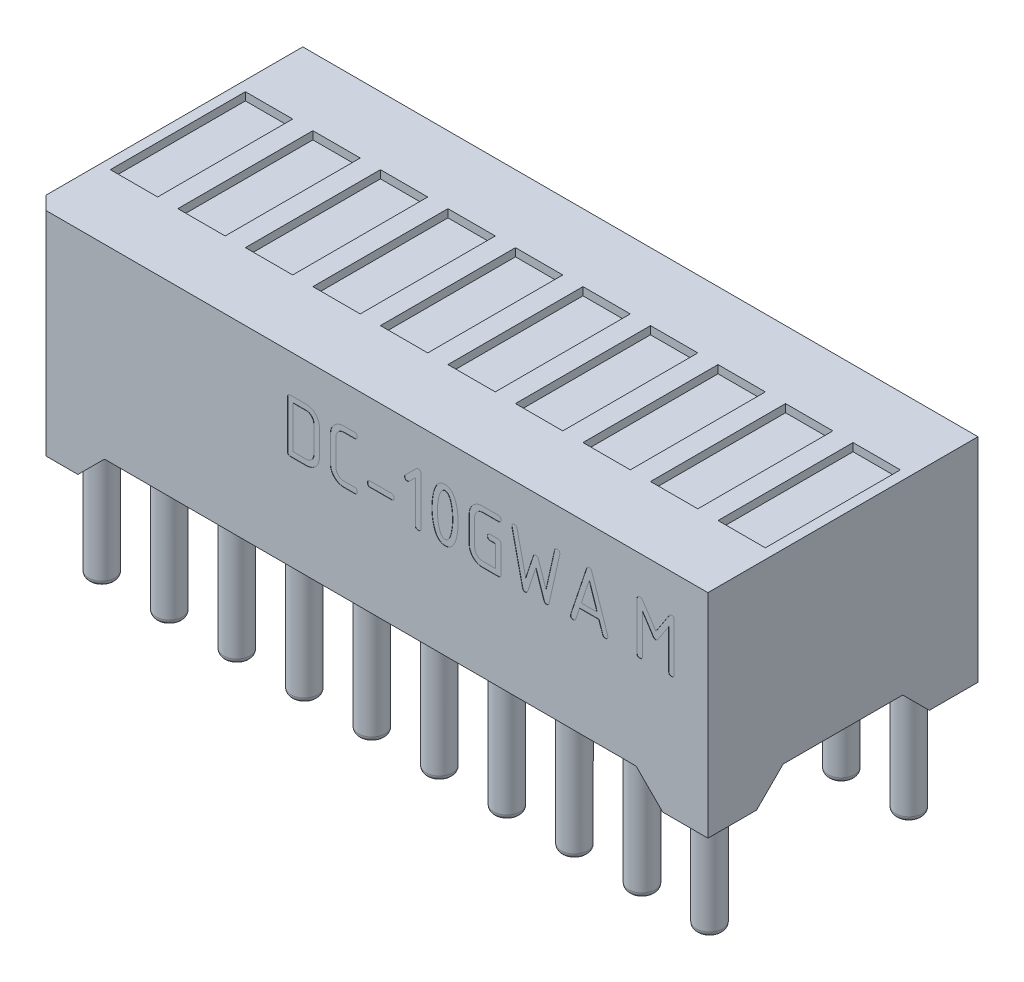
from build123d import *

# Parameters (mm, degrees)
SKETCH_1_W                 = 25.4
SKETCH_1_H                 = 10.16
EXTRUDE_1_DEPTH            = 8
SKETCH_2_W                 = 4.5
SKETCH_2_H                 = 2
CUT_EXTRUDE_1_DEPTH        = 28.110263739
CHAMFER_1_SIZE             = 1
SKETCH_3_W                 = 20
SKETCH_3_H                 = 2
CUT_EXTRUDE_2_DEPTH        = 19.12499931
CHAMFER_2_SIZE             = 1
SKETCH_4_W                 = 1.78
SKETCH_4_H                 = 5.08
CUT_EXTRUDE_3_DEPTH        = 0.3
PATTERN_LINEAR_1_COUNT     = 6
PATTERN_LINEAR_1_PITCH     = 2.54
PATTERN_LINEAR_1_COL_COUNT = 5
PATTERN_LINEAR_1_COL_PITCH = 2.54
SKETCH_5_R                 = 0.5
EXTRUDE_2_DEPTH            = 5.2
PATTERN_LINEAR_2_COUNT     = 6
PATTERN_LINEAR_2_PITCH     = 2.54
PATTERN_LINEAR_2_COL_COUNT = 5
PATTERN_LINEAR_2_COL_PITCH = 2.54
FILLET_1_R                 = 0.2
CHAMFER_3_SIZE             = 0.5
CUT_EXTRUDE_4_DEPTH        = 0.01


with BuildPart() as part:
    # Эскиз1 → Бобышка-Вытянуть1 (new body)
    with BuildSketch(Plane(origin=(0, 0, 0), x_dir=(1, 0, 0), z_dir=(0, 1, 0))):
        Rectangle(SKETCH_1_W, SKETCH_1_H)
    extrude(amount=EXTRUDE_1_DEPTH)

    # Эскиз2 → Вырез-Вытянуть1 (cut, through all)
    with BuildSketch(Plane(origin=(12.7, 0, 0), x_dir=(0, 0, -1), z_dir=(1, 0, 0))):
        Rectangle(SKETCH_2_W, SKETCH_2_H)
    extrude(amount=-CUT_EXTRUDE_1_DEPTH, mode=Mode.SUBTRACT)

    # Фаска1
    chamfer_1_edges = [part.edges().sort_by_distance(p)[0] for p in [
        (0, 0, -2.25),
        (0, 0, 2.25),
    ]]
    chamfer(chamfer_1_edges, length=CHAMFER_1_SIZE - 0.0001)  # a hair under: the kernel refuses the full size

    # Эскиз3 → Вырез-Вытянуть2 (cut, through all)
    with BuildSketch(Plane(origin=(0, 0, -5.08), x_dir=(-1, 0, 0), z_dir=(0, 0, -1))):
        Rectangle(SKETCH_3_W, SKETCH_3_H)
    extrude(amount=-CUT_EXTRUDE_2_DEPTH, mode=Mode.SUBTRACT)

    # Фаска2
    chamfer_2_edges = [part.edges().sort_by_distance(p)[0] for p in [
        (-10, 0, 4.16495),
        (10, 0, 4.16495),
        (-10, 0, -4.16495),
        (10, 0, -4.16495),
    ]]
    chamfer(chamfer_2_edges, length=CHAMFER_2_SIZE - 0.0001)  # a hair under: the kernel refuses the full size

    # Эскиз4 → Вырез-Вытянуть3 (cut)
    with BuildSketch(Plane(origin=(0, 8, 0), x_dir=(1, 0, 0), z_dir=(0, 1, 0))):
        with Locations((1.27, 0)):
            Rectangle(SKETCH_4_W, SKETCH_4_H)
    cut_extrude_3 = extrude(amount=-CUT_EXTRUDE_3_DEPTH, mode=Mode.SUBTRACT)

    # Линейный массив1: Вырез-Вытянуть3 ×6
    with Locations(*[(-i * PATTERN_LINEAR_1_PITCH, 0, 0) for i in range(1, PATTERN_LINEAR_1_COUNT)]):
        add(cut_extrude_3, mode=Mode.SUBTRACT)

    # Линейный массив1 col: Вырез-Вытянуть3 ×5
    with Locations(*[(i * PATTERN_LINEAR_1_COL_PITCH, 0, 0) for i in range(1, PATTERN_LINEAR_1_COL_COUNT)]):
        add(cut_extrude_3, mode=Mode.SUBTRACT)

    # Эскиз5 → Бобышка-Вытянуть2 (add)
    with BuildSketch(Plane.XZ.offset(-1)):
        with Locations(Location((-1.27, 3.75, 0), (0, 0, 90))):
            Circle(SKETCH_5_R)
        with Locations(Location((-1.27, -3.75, 0), (0, 0, 90))):
            Circle(SKETCH_5_R)
    extrude_2 = extrude(amount=EXTRUDE_2_DEPTH)

    # Линейный массив2: Бобышка-Вытянуть2 ×6
    with Locations(*[(i * PATTERN_LINEAR_2_PITCH, 0, 0) for i in range(1, PATTERN_LINEAR_2_COUNT)]):
        add(extrude_2)

    # Линейный массив2 col: Бобышка-Вытянуть2 ×5
    with Locations(*[(-i * PATTERN_LINEAR_2_COL_PITCH, 0, 0) for i in range(1, PATTERN_LINEAR_2_COL_COUNT)]):
        add(extrude_2)

    # Скругление1
    fillet_1_edges = [part.edges().sort_by_distance(p)[0] for p in [
        (-1.27, -4.2, 3.25),
        (-1.27, -4.2, -4.25),
        (-3.81, -4.2, 3.25),
        (-3.81, -4.2, -4.25),
        (-6.35, -4.2, 3.25),
        (-6.35, -4.2, -4.25),
        (-8.89, -4.2, 3.25),
        (-8.89, -4.2, -4.25),
        (-11.43, -4.2, 3.25),
        (-11.43, -4.2, -4.25),
        (1.27, -4.2, 3.25),
        (1.27, -4.2, -4.25),
        (3.81, -4.2, 3.25),
        (3.81, -4.2, -4.25),
        (6.35, -4.2, 3.25),
        (6.35, -4.2, -4.25),
        (8.89, -4.2, 3.25),
        (8.89, -4.2, -4.25),
        (11.43, -4.2, 3.25),
        (11.43, -4.2, -4.25),
    ]]
    fillet(fillet_1_edges, radius=FILLET_1_R)

    # Фаска3
    chamfer_3_edges = [part.edges().sort_by_distance(p)[0] for p in [
        (-12.7, 4, 5.08),
    ]]
    chamfer(chamfer_3_edges, length=CHAMFER_3_SIZE)

    # Эскиз6 → Вырез-Вытянуть4 (cut)
    # profile 1 of 9: a face of its own
    with BuildSketch(Plane.XY.offset(5.08)):
        with BuildLine():
            add(Edge.make_bspline(
                [(-3.111938351, 6.481594752), (-3.11162622, 6.489459708), (-3.111039228, 6.504250489), (-3.106750763, 6.524996341), (-3.098857909, 6.542564769), (-3.087902757, 6.557320883), (-3.072859942, 6.567828954), (-3.055630956, 6.576386623), (-3.034868168, 6.580459432), (-3.020228181, 6.581096436), (-3.012506533, 6.581432414)],
                knots=[0, 0, 0, 0, 1.168332916, 2.197158541, 3.123535467, 4.011857721, 4.888049796, 5.822888943, 6.851714568, 8, 8, 8, 8], degree=3))
            Line((-3.012506533, 6.581432414), (-2.415103936, 6.581432414))
            add(Edge.make_bspline(
                [(-2.415103936, 6.581432414), (-2.397904763, 6.580911898), (-2.364194753, 6.579891696), (-2.314525617, 6.573403355), (-2.266969092, 6.561963277), (-2.221384675, 6.546157153), (-2.177872273, 6.52578001), (-2.136924791, 6.500165619), (-2.097186729, 6.471150891), (-2.060689868, 6.437028465), (-2.027311367, 6.400078926), (-1.997648185, 6.360876687), (-1.972887784, 6.319311947), (-1.952455029, 6.275678684), (-1.936603928, 6.229971248), (-1.925117373, 6.182288043), (-1.918700521, 6.132472784), (-1.917661284, 6.098630599), (-1.917133157, 6.081432414)],
                knots=[0, 0, 0, 0, 1.049457071, 2.056913407, 3.049929083, 4.028847935, 4.996249898, 5.974472506, 6.97159638, 7.993822638, 9.016581965, 10.007090152, 10.98809477, 11.962968485, 12.941887336, 13.934903012, 14.950542929, 16, 16, 16, 16], degree=3))
            Line((-1.917133157, 6.081432414), (-1.917133157, 5.081432414))
            add(Edge.make_bspline(
                [(-1.917133157, 5.081432414), (-1.917662537, 5.064503571), (-1.918708224, 5.031063972), (-1.925158481, 4.981805851), (-1.936463584, 4.934410267), (-1.953091029, 4.889216573), (-1.973178228, 4.845444183), (-1.998616316, 4.803961511), (-2.028534909, 4.76442838), (-2.06214729, 4.726993604), (-2.099324385, 4.693278751), (-2.1384694, 4.663149498), (-2.179981053, 4.638146615), (-2.223177377, 4.61707282), (-2.268480409, 4.601376355), (-2.315615849, 4.589891486), (-2.364705723, 4.582892088), (-2.398171231, 4.581922833), (-2.415103936, 4.581432414)],
                knots=[0, 0, 0, 0, 1.03519463, 2.0448233, 3.031937184, 4.007931936, 4.984907729, 5.972298853, 6.976525039, 8.013172852, 9.043696885, 10.04132603, 11.028717155, 12.001762851, 12.974984337, 13.954059048, 14.96480537, 16, 16, 16, 16], degree=3))
            Line((-2.415103936, 4.581432414), (-3.012506533, 4.581432414))
            add(Edge.make_bspline(
                [(-3.012506533, 4.581432414), (-3.020230997, 4.581765001), (-3.034876323, 4.582395574), (-3.055603334, 4.586511474), (-3.073024987, 4.59496228), (-3.087625618, 4.605968874), (-3.099005597, 4.620306331), (-3.106719007, 4.637896492), (-3.111048827, 4.658605874), (-3.111629552, 4.673402181), (-3.111938351, 4.681270076)],
                knots=[0, 0, 0, 0, 1.148816053, 2.178117097, 3.113388232, 4.002120978, 4.875021152, 5.801826155, 6.831127199, 8, 8, 8, 8], degree=3))
            Line((-3.111938351, 4.681270076), (-3.111938351, 6.481594752))
        make_face()
        with BuildLine():
            Line((-2.904146144, 6.373640206), (-2.904146144, 4.789224622))
            Line((-2.904146144, 4.789224622), (-2.417133157, 4.789224622))
            add(Edge.make_bspline(
                [(-2.417133157, 4.789224622), (-2.397507578, 4.790080265), (-2.359120354, 4.791753885), (-2.304386844, 4.809696219), (-2.253642744, 4.836643393), (-2.209324884, 4.874944075), (-2.171993535, 4.920259664), (-2.144738329, 4.971563348), (-2.127647713, 5.027463721), (-2.125844893, 5.066428538), (-2.124925364, 5.086302544)],
                knots=[0, 0, 0, 0, 1.014160611, 1.983677042, 2.956612849, 3.976867765, 4.998953513, 5.984250618, 6.971866922, 8, 8, 8, 8], degree=3))
            Line((-2.124925364, 5.086302544), (-2.124925364, 6.076562284))
            add(Edge.make_bspline(
                [(-2.124925364, 6.076562284), (-2.125851315, 6.0964322), (-2.127666727, 6.135388995), (-2.144630787, 6.191232311), (-2.172143997, 6.242223522), (-2.203055349, 6.280090366), (-2.232031583, 6.306866551), (-2.255088292, 6.324703585), (-2.279270134, 6.34010751), (-2.304925682, 6.352023919), (-2.33131652, 6.361964982), (-2.358935148, 6.368920406), (-2.387650268, 6.373032541), (-2.407244129, 6.373436386), (-2.417133157, 6.373640206)],
                knots=[0, 0, 0, 0, 1.541734475, 3.022712119, 4.490935413, 6.023601629, 6.797673405, 7.555057682, 8.28756636, 9.021508447, 9.750307429, 10.477358599, 11.231522441, 12, 12, 12, 12], degree=3))
            Line((-2.417133157, 6.373640206), (-2.904146144, 6.373640206))
        make_face(mode=Mode.SUBTRACT)
    # profile 2 of 9: a face of its own
    with BuildSketch(Plane.XY.offset(5.08)):
        with BuildLine():
            add(Edge.make_bspline(
                [(-0.591240299, 6.581432414), (-0.583361415, 6.581172043), (-0.568514065, 6.580681387), (-0.547736914, 6.575692647), (-0.529899354, 6.567803837), (-0.515528458, 6.55585526), (-0.504404806, 6.540797618), (-0.496099985, 6.522616273), (-0.491931179, 6.500987455), (-0.491320796, 6.485668104), (-0.490996793, 6.47753631)],
                knots=[0, 0, 0, 0, 1.14095523, 2.150070966, 3.080760824, 3.945153579, 4.828279774, 5.776800167, 6.819884637, 8, 8, 8, 8], degree=3))
            add(Edge.make_bspline(
                [(-0.490996793, 6.47753631), (-0.491320796, 6.469404517), (-0.491931179, 6.454085166), (-0.496099985, 6.432456347), (-0.504404806, 6.414275002), (-0.515528458, 6.399217361), (-0.529899354, 6.387268784), (-0.547736914, 6.379379974), (-0.568514065, 6.374391233), (-0.583361415, 6.373900577), (-0.591240299, 6.373640206)],
                knots=[0, 0, 0, 0, 1.180115363, 2.223199833, 3.171720226, 4.054846421, 4.919239176, 5.849929034, 6.85904477, 8, 8, 8, 8], degree=3))
            Line((-0.591240299, 6.373640206), (-0.99262017, 6.373640206))
            add(Edge.make_bspline(
                [(-0.99262017, 6.373640206), (-1.002914858, 6.373437363), (-1.023316562, 6.373035374), (-1.053236587, 6.368906429), (-1.081960394, 6.362040299), (-1.109277872, 6.35202217), (-1.135741294, 6.340122394), (-1.160728288, 6.324708736), (-1.184569568, 6.307000257), (-1.206844358, 6.286724154), (-1.226987313, 6.264492319), (-1.244844528, 6.241043376), (-1.260112192, 6.216522914), (-1.272238388, 6.19070489), (-1.282142722, 6.163872376), (-1.28898181, 6.135690153), (-1.293158023, 6.106451299), (-1.293555792, 6.086587088), (-1.293756533, 6.076562284)],
                knots=[0, 0, 0, 0, 1.048872021, 2.078622972, 3.071996665, 4.053429411, 5.040658069, 6.024509927, 7.039472989, 8.064503896, 9.089534802, 10.093477104, 11.065564512, 12.027820687, 12.99628217, 13.976260581, 14.978686353, 16, 16, 16, 16], degree=3))
            Line((-1.293756533, 6.076562284), (-1.293756533, 5.086302544))
            add(Edge.make_bspline(
                [(-1.293756533, 5.086302544), (-1.293597861, 5.076272565), (-1.293283142, 5.056378556), (-1.288487742, 5.027195971), (-1.281614947, 4.999096781), (-1.27245724, 4.971949958), (-1.259465305, 4.946398949), (-1.244602219, 4.921460552), (-1.226553892, 4.897861318), (-1.206028357, 4.875712057), (-1.183363822, 4.855611139), (-1.159654623, 4.837647475), (-1.134474165, 4.8229401), (-1.108396426, 4.810712064), (-1.081136776, 4.800845015), (-1.052557032, 4.793997506), (-1.022912982, 4.789823811), (-1.002779957, 4.789425582), (-0.99262017, 4.789224622)],
                knots=[0, 0, 0, 0, 1.022100548, 2.027290177, 3.008023641, 3.972602167, 4.941613295, 5.926223191, 6.93093901, 7.966093497, 9.002167549, 10.017912619, 10.995436454, 11.970912299, 12.953101218, 13.947240284, 14.964109795, 16, 16, 16, 16], degree=3))
            Line((-0.99262017, 4.789224622), (-0.591240299, 4.789224622))
            add(Edge.make_bspline(
                [(-0.591240299, 4.789224622), (-0.583361415, 4.788964251), (-0.568514065, 4.788473595), (-0.547736914, 4.783484855), (-0.529899354, 4.775596045), (-0.515528458, 4.763647467), (-0.504404806, 4.748589826), (-0.496099985, 4.730408481), (-0.491931179, 4.708779662), (-0.491320796, 4.693460311), (-0.490996793, 4.685328518)],
                knots=[0, 0, 0, 0, 1.14095523, 2.150070966, 3.080760824, 3.945153579, 4.828279774, 5.776800167, 6.819884637, 8, 8, 8, 8], degree=3))
            add(Edge.make_bspline(
                [(-0.490996793, 4.685328518), (-0.491320796, 4.677196725), (-0.491931179, 4.661877374), (-0.496099985, 4.640248555), (-0.504404806, 4.62206721), (-0.515528458, 4.607009569), (-0.529899354, 4.595060991), (-0.547736914, 4.587172181), (-0.568514065, 4.582183441), (-0.583361415, 4.581692785), (-0.591240299, 4.581432414)],
                knots=[0, 0, 0, 0, 1.180115363, 2.223199833, 3.171720226, 4.054846421, 4.919239176, 5.849929034, 6.85904477, 8, 8, 8, 8], degree=3))
            Line((-0.591240299, 4.581432414), (-0.99262017, 4.581432414))
            add(Edge.make_bspline(
                [(-0.99262017, 4.581432414), (-1.00968912, 4.581918784), (-1.043425941, 4.582880096), (-1.093033385, 4.589957579), (-1.140758094, 4.601272704), (-1.186745446, 4.617269069), (-1.230910314, 4.637991071), (-1.273337675, 4.663266774), (-1.313672374, 4.69322467), (-1.352028886, 4.726978566), (-1.386846146, 4.764306072), (-1.417666005, 4.803823364), (-1.443356138, 4.845547306), (-1.464466558, 4.889086925), (-1.481376225, 4.934404635), (-1.493099798, 4.981781308), (-1.50008043, 5.031034339), (-1.501055421, 5.064499756), (-1.501548741, 5.081432414)],
                knots=[0, 0, 0, 0, 1.033160495, 2.042044265, 3.027381031, 3.998729981, 4.984373063, 5.976054975, 6.983508152, 8.022140711, 9.065188135, 10.069440076, 11.051366889, 12.025749804, 12.994920877, 13.974248187, 14.975020566, 16, 16, 16, 16], degree=3))
            Line((-1.501548741, 5.081432414), (-1.501548741, 6.081432414))
            add(Edge.make_bspline(
                [(-1.501548741, 6.081432414), (-1.501055431, 6.098365083), (-1.500080462, 6.131830521), (-1.493099674, 6.181083399), (-1.481376678, 6.228460636), (-1.464464883, 6.273776266), (-1.443362449, 6.317323694), (-1.417642022, 6.359018014), (-1.386999867, 6.398571882), (-1.351744892, 6.435458088), (-1.313833199, 6.469682454), (-1.27331471, 6.499573162), (-1.230916388, 6.524880341), (-1.18674385, 6.54559403), (-1.140758526, 6.561592592), (-1.093033267, 6.572907121), (-1.043425972, 6.579984766), (-1.00968913, 6.580946055), (-0.99262017, 6.581432414)],
                knots=[0, 0, 0, 0, 1.025012923, 2.025817999, 3.005177306, 3.974380044, 4.948794794, 5.930753689, 6.935038441, 7.972153624, 9.01626368, 10.023749773, 11.015464086, 12.001139371, 12.972520057, 13.957889016, 14.966805749, 16, 16, 16, 16], degree=3))
            Line((-0.99262017, 6.581432414), (-0.591240299, 6.581432414))
        make_face()
    # profile 3 of 9: a face of its own
    with BuildSketch(Plane.XY.offset(5.08)):
        with BuildLine():
            Line((0.797152558, 5.074938908), (-0.005607183, 5.074938908))
            add(Edge.make_bspline(
                [(-0.005607183, 5.074938908), (-0.013486067, 5.075199279), (-0.028333417, 5.075689935), (-0.049110568, 5.080678675), (-0.066948128, 5.088567485), (-0.081319024, 5.100516062), (-0.092442676, 5.115573704), (-0.100747497, 5.133755049), (-0.104916303, 5.155383867), (-0.105526686, 5.170703218), (-0.105850689, 5.178835012)],
                knots=[0, 0, 0, 0, 1.14095523, 2.150070966, 3.080760824, 3.945153579, 4.828279774, 5.776800167, 6.819884637, 8, 8, 8, 8], degree=3))
            add(Edge.make_bspline(
                [(-0.105850689, 5.178835012), (-0.105526686, 5.186966805), (-0.104916303, 5.202286156), (-0.100747497, 5.223914974), (-0.092442676, 5.242096319), (-0.081319024, 5.257153961), (-0.066948128, 5.269102538), (-0.049110568, 5.276991348), (-0.028333417, 5.281980088), (-0.013486067, 5.282470744), (-0.005607183, 5.282731115)],
                knots=[0, 0, 0, 0, 1.180115363, 2.223199833, 3.171720226, 4.054846421, 4.919239176, 5.849929034, 6.85904477, 8, 8, 8, 8], degree=3))
            Line((-0.005607183, 5.282731115), (0.797152558, 5.282731115))
            add(Edge.make_bspline(
                [(0.797152558, 5.282731115), (0.805031442, 5.282470744), (0.819878792, 5.281980088), (0.840655943, 5.276991348), (0.858493503, 5.269102538), (0.872864399, 5.257153961), (0.883988051, 5.242096319), (0.892292872, 5.223914974), (0.896461678, 5.202286156), (0.897072062, 5.186966805), (0.897396064, 5.178835012)],
                knots=[0, 0, 0, 0, 1.14095523, 2.150070966, 3.080760824, 3.945153579, 4.828279774, 5.776800167, 6.819884637, 8, 8, 8, 8], degree=3))
            add(Edge.make_bspline(
                [(0.897396064, 5.178835012), (0.897072062, 5.170703218), (0.896461678, 5.155383867), (0.892292872, 5.133755049), (0.883988051, 5.115573704), (0.872864399, 5.100516062), (0.858493503, 5.088567485), (0.840655943, 5.080678675), (0.819878792, 5.075689935), (0.805031442, 5.075199279), (0.797152558, 5.074938908)],
                knots=[0, 0, 0, 0, 1.180115363, 2.223199833, 3.171720226, 4.054846421, 4.919239176, 5.849929034, 6.85904477, 8, 8, 8, 8], degree=3))
        make_face()
    # profile 4 of 9: a face of its own
    with BuildSketch(Plane.XY.offset(5.08)):
        with BuildLine():
            Line((1.693256454, 6.240523323), (1.461925285, 6.009597999))
            add(Edge.make_bspline(
                [(1.461925285, 6.009597999), (1.457093834, 6.005160953), (1.447605145, 5.996446853), (1.430385748, 5.987615947), (1.411891231, 5.981417723), (1.398802698, 5.980997577), (1.39212009, 5.980783063)],
                knots=[0, 0, 0, 0, 1.010414873, 1.9843964, 2.970894036, 4, 4, 4, 4], degree=3))
            add(Edge.make_bspline(
                [(1.39212009, 5.980783063), (1.384254516, 5.981097694), (1.369462573, 5.981689387), (1.348547484, 5.985983154), (1.33090442, 5.99406498), (1.316564543, 6.005471023), (1.3051585, 6.0198109), (1.297076674, 6.037453964), (1.292782907, 6.058369053), (1.292191214, 6.073160996), (1.291876584, 6.08102657)],
                knots=[0, 0, 0, 0, 1.161746488, 2.184772153, 3.132421671, 4, 4.867578329, 5.815227847, 6.838253512, 8, 8, 8, 8], degree=3))
            add(Edge.make_bspline(
                [(1.291876584, 6.08102657), (1.292091097, 6.087709178), (1.292511243, 6.100797711), (1.298709467, 6.119292228), (1.307540373, 6.136511625), (1.316254473, 6.146000314), (1.320691519, 6.150831765)],
                knots=[0, 0, 0, 0, 1.029105964, 2.0156036, 2.989585127, 4, 4, 4, 4], degree=3))
            Line((1.320691519, 6.150831765), (1.713548662, 6.542065531))
            add(Edge.make_bspline(
                [(1.713548662, 6.542065531), (1.720294816, 6.547943584), (1.733135092, 6.55913156), (1.753987688, 6.572149317), (1.775517384, 6.579916015), (1.790061945, 6.580935436), (1.797152558, 6.581432414)],
                knots=[0, 0, 0, 0, 1.133619088, 2.157671026, 3.101847036, 4, 4, 4, 4], degree=3))
            add(Edge.make_bspline(
                [(1.797152558, 6.581432414), (1.805281291, 6.58110471), (1.820594877, 6.580487355), (1.842261954, 6.576364819), (1.860244024, 6.567941584), (1.875760138, 6.557339084), (1.887148424, 6.542606675), (1.895439654, 6.525039644), (1.900267011, 6.504302594), (1.900777674, 6.48946726), (1.901048662, 6.481594752)],
                knots=[0, 0, 0, 0, 1.182206815, 2.227139885, 3.177341287, 4.050378394, 4.931567696, 5.846118584, 6.857022719, 8, 8, 8, 8], degree=3))
            Line((1.901048662, 6.481594752), (1.901048662, 4.681270076))
            add(Edge.make_bspline(
                [(1.901048662, 4.681270076), (1.900780937, 4.673394597), (1.900276423, 4.658553664), (1.895408302, 4.637853731), (1.887296704, 4.62025974), (1.875483314, 4.605958719), (1.860410422, 4.594841991), (1.842233568, 4.586535131), (1.820603388, 4.582366942), (1.805284242, 4.581756466), (1.797152558, 4.581432414)],
                knots=[0, 0, 0, 0, 1.143493343, 2.154853909, 3.069817724, 3.936133365, 4.82122412, 5.771854545, 6.81725941, 8, 8, 8, 8], degree=3))
            add(Edge.make_bspline(
                [(1.797152558, 4.581432414), (1.789020873, 4.581756466), (1.773701727, 4.582366942), (1.752071547, 4.586535131), (1.733894694, 4.594841991), (1.718821801, 4.605958719), (1.707008411, 4.62025974), (1.698896813, 4.637853731), (1.694028692, 4.658553664), (1.693524179, 4.673394597), (1.693256454, 4.681270076)],
                knots=[0, 0, 0, 0, 1.18274059, 2.228145455, 3.17877588, 4.063866635, 4.930182276, 5.845146091, 6.856506657, 8, 8, 8, 8], degree=3))
            Line((1.693256454, 4.681270076), (1.693256454, 6.240523323))
        make_face()
    # profile 5 of 9: a face of its own
    with BuildSketch(Plane.XY.offset(5.08)):
        with BuildLine():
            add(Edge.make_bspline(
                [(3.303646064, 5.581432414), (3.303446087, 5.552072104), (3.303053303, 5.494404246), (3.298964508, 5.409518864), (3.291912482, 5.327792882), (3.282984013, 5.248905905), (3.270000871, 5.173217427), (3.255795443, 5.100209682), (3.23792164, 5.030500918), (3.223755139, 4.985459656), (3.216795415, 4.963331765)],
                knots=[0, 0, 0, 0, 1.124122115, 2.207936967, 3.252792157, 4.264709158, 5.24654949, 6.192297675, 7.111911229, 8, 8, 8, 8], degree=3))
            add(Edge.make_bspline(
                [(3.216795415, 4.963331765), (3.211344771, 4.947876092), (3.20070586, 4.917708734), (3.183532413, 4.874122208), (3.164171636, 4.833998097), (3.144520378, 4.796535787), (3.123349962, 4.762136392), (3.100542715, 4.73102926), (3.077016807, 4.702391615), (3.052333189, 4.67669628), (3.026134087, 4.654293717), (2.998988701, 4.63462168), (2.970326248, 4.618353601), (2.940575848, 4.604911787), (2.909650355, 4.594185591), (2.877490623, 4.587086531), (2.844232732, 4.582383461), (2.821655098, 4.581753646), (2.810139571, 4.581432414)],
                knots=[0, 0, 0, 0, 1.310937216, 2.558770053, 3.744633683, 4.872553198, 5.941578919, 6.971839658, 7.955529983, 8.904443025, 9.817575395, 10.709429987, 11.581838559, 12.44872678, 13.317908182, 14.194667946, 15.079205918, 16, 16, 16, 16], degree=3))
            add(Edge.make_bspline(
                [(2.810139571, 4.581432414), (2.79862401, 4.5817536), (2.776046312, 4.582383326), (2.742788889, 4.587087042), (2.710627413, 4.594183696), (2.679708365, 4.60491879), (2.649933964, 4.618327461), (2.621430223, 4.634681874), (2.593994261, 4.653817874), (2.568109421, 4.676323941), (2.54311554, 4.701568981), (2.519760103, 4.730241812), (2.49692565, 4.761319329), (2.475747097, 4.795719652), (2.456218752, 4.833103725), (2.436630571, 4.872985365), (2.419669003, 4.916392407), (2.408952999, 4.946395369), (2.403483726, 4.961708388)],
                knots=[0, 0, 0, 0, 0.922751779, 1.809170365, 2.687794204, 3.55882357, 4.427554879, 5.301818276, 6.189297488, 7.104371266, 8.047541495, 9.03332324, 10.065774413, 11.137072986, 12.267390567, 13.445988621, 14.696474471, 16, 16, 16, 16], degree=3))
            add(Edge.make_bspline(
                [(2.403483726, 4.961708388), (2.396522483, 4.983836135), (2.38235289, 5.028877105), (2.364470216, 5.098716725), (2.350159013, 5.171826728), (2.33798301, 5.247766279), (2.328124257, 5.326800383), (2.321394112, 5.408987478), (2.317213404, 5.494267012), (2.316828556, 5.552071397), (2.316633077, 5.581432414)],
                knots=[0, 0, 0, 0, 0.8858338, 1.803112338, 2.751524911, 3.73004053, 4.740009457, 5.792508504, 6.878732174, 8, 8, 8, 8], degree=3))
            add(Edge.make_bspline(
                [(2.316633077, 5.581432414), (2.316828556, 5.610793432), (2.317213404, 5.668597816), (2.321394112, 5.75387735), (2.328124257, 5.836064445), (2.33798301, 5.915098549), (2.350159013, 5.9910381), (2.364470216, 6.064148103), (2.38235289, 6.133987723), (2.396522483, 6.179028693), (2.403483726, 6.20115644)],
                knots=[0, 0, 0, 0, 1.121267826, 2.207491496, 3.259990543, 4.26995947, 5.248475089, 6.196887662, 7.1141662, 8, 8, 8, 8], degree=3))
            add(Edge.make_bspline(
                [(2.403483726, 6.20115644), (2.408952999, 6.21646946), (2.419669003, 6.246472421), (2.436630571, 6.289879464), (2.456218752, 6.329761103), (2.475747097, 6.367145177), (2.49692565, 6.401545499), (2.519760103, 6.432623017), (2.54311554, 6.461295847), (2.568109421, 6.486540887), (2.593994261, 6.509046954), (2.621430223, 6.528182954), (2.649933964, 6.544537367), (2.679708365, 6.557946038), (2.710627413, 6.568681133), (2.742788889, 6.575777786), (2.776046312, 6.580481502), (2.79862401, 6.581111228), (2.810139571, 6.581432414)],
                knots=[0, 0, 0, 0, 1.303525529, 2.554011379, 3.732609433, 4.862927014, 5.934225587, 6.96667676, 7.952458505, 8.895628734, 9.810702512, 10.698181724, 11.572445121, 12.44117643, 13.312205796, 14.190829635, 15.077248221, 16, 16, 16, 16], degree=3))
            add(Edge.make_bspline(
                [(2.810139571, 6.581432414), (2.821655098, 6.581111182), (2.844232732, 6.580481367), (2.877490623, 6.575778298), (2.909650355, 6.568679237), (2.940575848, 6.557953042), (2.970326248, 6.544511227), (2.998988701, 6.528243148), (3.026134087, 6.508571112), (3.052333189, 6.486168548), (3.077016807, 6.460473213), (3.100542715, 6.431835568), (3.123349962, 6.400728436), (3.144520378, 6.366329041), (3.164171636, 6.328866731), (3.183532413, 6.28874262), (3.20070586, 6.245156094), (3.211344771, 6.214988736), (3.216795415, 6.199533063)],
                knots=[0, 0, 0, 0, 0.920794082, 1.805332054, 2.682091818, 3.55127322, 4.418161441, 5.290570013, 6.182424605, 7.095556975, 8.044470017, 9.028160342, 10.058421081, 11.127446802, 12.255366317, 13.441229947, 14.689062784, 16, 16, 16, 16], degree=3))
            add(Edge.make_bspline(
                [(3.216795415, 6.199533063), (3.223755139, 6.177405173), (3.23792164, 6.13236391), (3.255795443, 6.062655146), (3.270000871, 5.989647401), (3.282984013, 5.913958923), (3.291912482, 5.835071947), (3.298964508, 5.753345964), (3.303053303, 5.668460582), (3.303446087, 5.610792724), (3.303646064, 5.581432414)],
                knots=[0, 0, 0, 0, 0.888088771, 1.807702325, 2.75345051, 3.735290842, 4.747207843, 5.792063033, 6.875877885, 8, 8, 8, 8], degree=3))
        make_face()
        with BuildLine():
            add(Edge.make_bspline(
                [(3.095853856, 5.581432414), (3.095216107, 5.62190037), (3.093958085, 5.701727347), (3.084411405, 5.819611538), (3.068972454, 5.93391441), (3.053284087, 6.008190887), (3.045529181, 6.04490644)],
                knots=[0, 0, 0, 0, 1.039450573, 2.050417306, 3.036303171, 4, 4, 4, 4], degree=3))
            add(Edge.make_bspline(
                [(3.045529181, 6.04490644), (3.039194308, 6.07073249), (3.027261189, 6.119381499), (3.003913824, 6.186364871), (2.978819931, 6.243457723), (2.951066598, 6.290607073), (2.919994246, 6.327263095), (2.886200449, 6.353750651), (2.849186791, 6.370592738), (2.823156727, 6.372624273), (2.810139571, 6.373640206)],
                knots=[0, 0, 0, 0, 1.471275363, 2.771468755, 3.921132639, 4.919028239, 5.789768561, 6.564141368, 7.281953516, 8, 8, 8, 8], degree=3))
            add(Edge.make_bspline(
                [(2.810139571, 6.373640206), (2.797250245, 6.372630546), (2.771465869, 6.370610778), (2.734841942, 6.353600614), (2.700949641, 6.327380107), (2.670514147, 6.289984581), (2.642776858, 6.242938237), (2.617915553, 6.185648652), (2.594640998, 6.118567886), (2.582707093, 6.069650917), (2.576373337, 6.043688908)],
                knots=[0, 0, 0, 0, 0.710859986, 1.422035665, 2.196661529, 3.068523522, 4.0731613, 5.213301773, 6.520998214, 8, 8, 8, 8], degree=3))
            add(Edge.make_bspline(
                [(2.576373337, 6.043688908), (2.568321942, 6.006438017), (2.552127699, 5.931513112), (2.53638908, 5.816771476), (2.526242575, 5.699853563), (2.525033894, 5.62109154), (2.524425285, 5.581432414)],
                knots=[0, 0, 0, 0, 0.980794436, 1.972729451, 2.979206291, 4, 4, 4, 4], degree=3))
            add(Edge.make_bspline(
                [(2.524425285, 5.581432414), (2.525070455, 5.541235479), (2.526347338, 5.461680039), (2.535854373, 5.344062426), (2.551389774, 5.229508156), (2.567004124, 5.154946375), (2.57474996, 5.117958388)],
                knots=[0, 0, 0, 0, 1.032536172, 2.043535662, 3.029453472, 4, 4, 4, 4], degree=3))
            add(Edge.make_bspline(
                [(2.57474996, 5.117958388), (2.58107569, 5.092126241), (2.592991586, 5.043465745), (2.616452289, 4.97655796), (2.641171787, 4.919268432), (2.669988421, 4.872865051), (2.700103091, 4.835474148), (2.734118194, 4.809146033), (2.771082785, 4.792264376), (2.797119226, 4.790237984), (2.810139571, 4.789224622)],
                knots=[0, 0, 0, 0, 1.471576835, 2.772036643, 3.921936099, 4.917559913, 5.789315674, 6.563847154, 7.281806385, 8, 8, 8, 8], degree=3))
            add(Edge.make_bspline(
                [(2.810139571, 4.789224622), (2.823158051, 4.790239482), (2.849190763, 4.792268871), (2.886184043, 4.809127473), (2.920146213, 4.835608107), (2.950797005, 4.872594424), (2.978978888, 4.919437727), (3.003877489, 4.976524316), (3.027272205, 5.043475944), (3.039198128, 5.092129778), (3.045529181, 5.117958388)],
                knots=[0, 0, 0, 0, 0.718110908, 1.435987458, 2.210429742, 3.086929906, 4.078515554, 5.228282587, 6.528592633, 8, 8, 8, 8], degree=3))
            add(Edge.make_bspline(
                [(3.045529181, 5.117958388), (3.053275018, 5.154946375), (3.068889368, 5.229508156), (3.084424769, 5.344062426), (3.093931803, 5.461680039), (3.095208686, 5.541235479), (3.095853856, 5.581432414)],
                knots=[0, 0, 0, 0, 0.970546528, 1.956464338, 2.967463828, 4, 4, 4, 4], degree=3))
        make_face(mode=Mode.SUBTRACT)
    # profile 6 of 9: a face of its own
    with BuildSketch(Plane.XY.offset(5.08)):
        with BuildLine():
            Line((4.21923048, 4.789224622), (4.706243467, 4.789224622))
            Line((4.706243467, 4.789224622), (4.706243467, 5.594419427))
            Line((4.706243467, 5.594419427), (4.505756454, 5.594419427))
            add(Edge.make_bspline(
                [(4.505756454, 5.594419427), (4.497879336, 5.594682288), (4.483035316, 5.595177636), (4.462235963, 5.600135092), (4.444376063, 5.608171865), (4.429686228, 5.619859855), (4.418416935, 5.634970421), (4.41084756, 5.653398264), (4.405852317, 5.674785365), (4.405365188, 5.690166483), (4.405107103, 5.698315531)],
                knots=[0, 0, 0, 0, 1.139314047, 2.146978242, 3.076329369, 3.954694466, 4.836550347, 5.7757666, 6.821582149, 8, 8, 8, 8], degree=3))
            add(Edge.make_bspline(
                [(4.405107103, 5.698315531), (4.405365188, 5.706464579), (4.405852317, 5.721845697), (4.41084756, 5.743232798), (4.418416935, 5.761660641), (4.429686228, 5.776771207), (4.444376063, 5.788459197), (4.462235963, 5.79649597), (4.483035316, 5.801453426), (4.497879336, 5.801948774), (4.505756454, 5.802211635)],
                knots=[0, 0, 0, 0, 1.178417851, 2.2242334, 3.163449653, 4.045305534, 4.923670631, 5.853021758, 6.860685953, 8, 8, 8, 8], degree=3))
            Line((4.505756454, 5.802211635), (4.810139571, 5.802211635))
            add(Edge.make_bspline(
                [(4.810139571, 5.802211635), (4.818290901, 5.801956518), (4.833676329, 5.801474992), (4.855034857, 5.796442596), (4.873633036, 5.788963879), (4.888470514, 5.77719518), (4.900298965, 5.762562952), (4.908389971, 5.744552607), (4.913261683, 5.723463616), (4.913767484, 5.708355505), (4.914035675, 5.700344752)],
                knots=[0, 0, 0, 0, 1.171023919, 2.210277543, 3.143600724, 4.031744389, 4.904598222, 5.828118175, 6.848406059, 8, 8, 8, 8], degree=3))
            Line((4.914035675, 5.700344752), (4.914035675, 4.683299297))
            add(Edge.make_bspline(
                [(4.914035675, 4.683299297), (4.913726475, 4.675295963), (4.913144481, 4.660231613), (4.908810499, 4.63913343), (4.901117346, 4.62112715), (4.889721011, 4.606460746), (4.875362472, 4.594806219), (4.857509668, 4.587171864), (4.837061381, 4.582202672), (4.822348126, 4.58169803), (4.814603856, 4.581432414)],
                knots=[0, 0, 0, 0, 1.176817173, 2.215075067, 3.150604205, 4.030281658, 4.92225351, 5.839615304, 6.862889227, 8, 8, 8, 8], degree=3))
            Line((4.814603856, 4.581432414), (4.217201259, 4.581432414))
            add(Edge.make_bspline(
                [(4.217201259, 4.581432414), (4.200268266, 4.581922281), (4.166802189, 4.582890444), (4.117716462, 4.589897798), (4.070565845, 4.601353551), (4.025203433, 4.617197781), (3.981798856, 4.637890298), (3.940482928, 4.663427268), (3.901031193, 4.693113887), (3.863848479, 4.727013996), (3.830253337, 4.764440882), (3.800238103, 4.803839165), (3.775351469, 4.845570983), (3.75516031, 4.889199706), (3.738568505, 4.934414836), (3.727253718, 4.981804597), (3.720806089, 5.031064298), (3.719760042, 5.06450368), (3.71923048, 5.081432414)],
                knots=[0, 0, 0, 0, 1.035018204, 2.045592267, 3.024500117, 3.997555739, 4.977895023, 5.958059853, 6.962114891, 7.992463294, 9.028934434, 10.032989472, 11.015941837, 11.992751126, 12.968579542, 13.955525194, 14.964981796, 16, 16, 16, 16], degree=3))
            Line((3.71923048, 5.081432414), (3.71923048, 6.081432414))
            add(Edge.make_bspline(
                [(3.71923048, 6.081432414), (3.719760031, 6.098361158), (3.720806056, 6.131800562), (3.727253845, 6.181060112), (3.738568043, 6.228450428), (3.755162014, 6.273663512), (3.775345086, 6.317299878), (3.800262309, 6.359002785), (3.830099051, 6.398432539), (3.864132301, 6.435432391), (3.900869098, 6.46978907), (3.940505805, 6.499413564), (3.981792786, 6.524980897), (4.025205046, 6.545665355), (4.070565412, 6.561511732), (4.117716582, 6.572966904), (4.166802158, 6.579974417), (4.200268256, 6.580942559), (4.217201259, 6.581432414)],
                knots=[0, 0, 0, 0, 1.035052368, 2.044542289, 3.031520518, 4.007381144, 4.984222675, 5.967207484, 6.971295664, 8.001678076, 9.037655306, 10.041743486, 11.021940669, 12.002312311, 12.975400051, 13.954340213, 14.964947632, 16, 16, 16, 16], degree=3))
            Line((4.217201259, 6.581432414), (4.814603856, 6.581432414))
            add(Edge.make_bspline(
                [(4.814603856, 6.581432414), (4.822341375, 6.581152938), (4.837041803, 6.580621965), (4.857631875, 6.575816025), (4.875246357, 6.56755672), (4.889875572, 6.556005766), (4.901100595, 6.540871416), (4.908813966, 6.522509226), (4.913140085, 6.501003346), (4.913725125, 6.485673614), (4.914035675, 6.47753631)],
                knots=[0, 0, 0, 0, 1.125605321, 2.13852561, 3.054900484, 3.937847236, 4.82430298, 5.768418294, 6.815435384, 8, 8, 8, 8], degree=3))
            add(Edge.make_bspline(
                [(4.914035675, 6.47753631), (4.913725619, 6.469398379), (4.913141511, 6.454067465), (4.908809224, 6.432569409), (4.901116093, 6.414181546), (4.889885195, 6.399220213), (4.87562378, 6.387383063), (4.858133058, 6.379359325), (4.83773787, 6.374394063), (4.823158606, 6.3739017), (4.815415545, 6.373640206)],
                knots=[0, 0, 0, 0, 1.189686143, 2.241230066, 3.189427312, 4.079715694, 4.951118706, 5.871455575, 6.869528066, 8, 8, 8, 8], degree=3))
            Line((4.815415545, 6.373640206), (4.223288921, 6.373640206))
            add(Edge.make_bspline(
                [(4.223288921, 6.373640206), (4.213128306, 6.373445406), (4.193127739, 6.373061952), (4.163757381, 6.368860922), (4.135564964, 6.362043097), (4.108655218, 6.352017852), (4.082591177, 6.34011885), (4.058019266, 6.324696405), (4.034561959, 6.307001228), (4.005565194, 6.279963801), (3.974185675, 6.242382356), (3.946753551, 6.191210431), (3.92975736, 6.135394748), (3.927946379, 6.096434143), (3.927022688, 6.076562284)],
                knots=[0, 0, 0, 0, 0.783284093, 1.541848201, 2.283425752, 3.016288116, 3.753890141, 4.489496346, 5.249208055, 6.017188591, 7.54440416, 9.001073873, 10.470397572, 12, 12, 12, 12], degree=3))
            Line((3.927022688, 6.076562284), (3.927022688, 5.086302544))
            add(Edge.make_bspline(
                [(3.927022688, 5.086302544), (3.927958484, 5.06616621), (3.929779376, 5.026984513), (3.946407351, 4.970584137), (3.973526079, 4.919337), (4.00447163, 4.881406601), (4.033190733, 4.854940179), (4.056057778, 4.837034528), (4.080556995, 4.822703765), (4.105876205, 4.810084112), (4.132719194, 4.801054562), (4.160484351, 4.793945614), (4.189479164, 4.789817688), (4.209206904, 4.789424433), (4.21923048, 4.789224622)],
                knots=[0, 0, 0, 0, 1.559043113, 3.0336186, 4.516942702, 6.031270688, 6.803536433, 7.544437166, 8.278694255, 9.001463699, 9.734895485, 10.470426221, 11.22283048, 12, 12, 12, 12], degree=3))
        make_face()
    # profile 7 of 9: a face of its own
    with BuildSketch(Plane.XY.offset(5.08)):
        with BuildLine():
            Line((6.607217493, 5.057081765), (6.929457752, 6.502698648))
            add(Edge.make_bspline(
                [(6.929457752, 6.502698648), (6.931214714, 6.508829904), (6.934606949, 6.520667764), (6.941707841, 6.537035747), (6.951375706, 6.550953483), (6.963035298, 6.562143668), (6.97656783, 6.571177733), (6.992238344, 6.577108291), (7.00977842, 6.580799824), (7.022105801, 6.581216721), (7.028483726, 6.581432414)],
                knots=[0, 0, 0, 0, 1.103421085, 2.130418932, 3.072213666, 4.016043459, 4.912203987, 5.868726437, 6.897324386, 8, 8, 8, 8], degree=3))
            add(Edge.make_bspline(
                [(7.028483726, 6.581432414), (7.036346246, 6.581114272), (7.051132444, 6.580515975), (7.072085767, 6.57626616), (7.089525446, 6.568073285), (7.104327576, 6.557170065), (7.115172708, 6.542485465), (7.123655316, 6.525107508), (7.127789766, 6.504233932), (7.128401791, 6.48945396), (7.128727233, 6.481594752)],
                knots=[0, 0, 0, 0, 1.163874652, 2.188774361, 3.138159845, 3.995021275, 4.879953763, 5.811225639, 6.836125348, 8, 8, 8, 8], degree=3))
            add(Edge.make_bspline(
                [(7.128727233, 6.481594752), (7.128516547, 6.478205505), (7.128042076, 6.470572835), (7.126656591, 6.463049897), (7.125886324, 6.458867479)],
                knots=[0, 0, 0, 0, 0.888089456, 2, 2, 2, 2], degree=3))
            Line((7.125886324, 6.458867479), (6.725723986, 4.664630466))
            add(Edge.make_bspline(
                [(6.725723986, 4.664630466), (6.723980102, 4.658091943), (6.720642493, 4.645577912), (6.713473573, 4.628298291), (6.703924498, 4.613765489), (6.692514819, 4.60170449), (6.678690471, 4.59263259), (6.663113771, 4.586228925), (6.645730504, 4.581917168), (6.633489993, 4.581598612), (6.627103856, 4.581432414)],
                knots=[0, 0, 0, 0, 1.145972405, 2.193268304, 3.15315274, 4.07706523, 4.986074929, 5.931067983, 6.920593755, 8, 8, 8, 8], degree=3))
            add(Edge.make_bspline(
                [(6.627103856, 4.581432414), (6.621397739, 4.581624644), (6.610235579, 4.582000679), (6.594092075, 4.586196006), (6.579372784, 4.593279757), (6.565684781, 4.602615569), (6.553795829, 4.615210949), (6.543379309, 4.6303657), (6.5337852, 4.647943287), (6.529238643, 4.661031046), (6.52686035, 4.667877219)],
                knots=[0, 0, 0, 0, 0.958052219, 1.874117284, 2.779953013, 3.69517, 4.644537148, 5.673456817, 6.782991133, 8, 8, 8, 8], degree=3))
            Line((6.52686035, 4.667877219), (6.225723986, 5.56641618))
            Line((6.225723986, 5.56641618), (5.926210999, 4.667877219))
            add(Edge.make_bspline(
                [(5.926210999, 4.667877219), (5.923822584, 4.661038236), (5.919256674, 4.647964224), (5.909757365, 4.630222991), (5.898834651, 4.615330378), (5.886997218, 4.602611588), (5.873206619, 4.593170594), (5.858146756, 4.586206982), (5.841614651, 4.581997853), (5.830185591, 4.581623665), (5.824344116, 4.581432414)],
                knots=[0, 0, 0, 0, 1.205164184, 2.303899826, 3.335924379, 4.276051698, 5.182361228, 6.099805198, 7.028796715, 8, 8, 8, 8], degree=3))
            add(Edge.make_bspline(
                [(5.824344116, 4.581432414), (5.818095844, 4.581615232), (5.805995585, 4.581969273), (5.788670571, 4.586167799), (5.773156072, 4.592926667), (5.759711841, 4.602822598), (5.747717641, 4.614870379), (5.73859955, 4.630406922), (5.730666574, 4.648068337), (5.727162072, 4.66104789), (5.725318142, 4.667877219)],
                knots=[0, 0, 0, 0, 1.039370201, 2.012820423, 2.95144101, 3.839980066, 4.780764623, 5.763052758, 6.823006546, 8, 8, 8, 8], degree=3))
            Line((5.725318142, 4.667877219), (5.325561649, 6.458867479))
            add(Edge.make_bspline(
                [(5.325561649, 6.458867479), (5.324791381, 6.463049897), (5.323405896, 6.470572835), (5.322931426, 6.478205505), (5.322720739, 6.481594752)],
                knots=[0, 0, 0, 0, 1.111910544, 2, 2, 2, 2], degree=3))
            add(Edge.make_bspline(
                [(5.322720739, 6.481594752), (5.323046182, 6.48945396), (5.323658206, 6.504233932), (5.327792657, 6.525107508), (5.336275265, 6.542485465), (5.347120396, 6.557170065), (5.361922527, 6.568073285), (5.379362206, 6.57626616), (5.400315529, 6.580515975), (5.415101727, 6.581114272), (5.422964246, 6.581432414)],
                knots=[0, 0, 0, 0, 1.163874652, 2.188774361, 3.120046237, 4.004978725, 4.861840155, 5.811225639, 6.836125348, 8, 8, 8, 8], degree=3))
            add(Edge.make_bspline(
                [(5.422964246, 6.581432414), (5.429342762, 6.581226904), (5.441538787, 6.580833959), (5.458944383, 6.57706869), (5.474511368, 6.571042691), (5.488364178, 6.562414928), (5.49964187, 6.550786129), (5.509357884, 6.537061574), (5.516428537, 6.520660495), (5.519825148, 6.508827424), (5.521584376, 6.502698648)],
                knots=[0, 0, 0, 0, 1.105431131, 2.11363673, 3.072549469, 3.990663523, 4.920109066, 5.864257286, 6.893821535, 8, 8, 8, 8], degree=3))
            Line((5.521584376, 6.502698648), (5.84423048, 5.054240856))
            Line((5.84423048, 5.054240856), (6.126698012, 5.901237609))
            add(Edge.make_bspline(
                [(6.126698012, 5.901237609), (6.129122421, 5.907794673), (6.133773496, 5.92037399), (6.142807362, 5.937508031), (6.15280017, 5.952433987), (6.164715755, 5.964327278), (6.178057897, 5.973567437), (6.192823592, 5.979972173), (6.208840735, 5.984305147), (6.220012804, 5.984660068), (6.225723986, 5.984841505)],
                knots=[0, 0, 0, 0, 1.19889364, 2.300002362, 3.317880372, 4.270336642, 5.172183342, 6.087092359, 7.022118078, 8, 8, 8, 8], degree=3))
            add(Edge.make_bspline(
                [(6.225723986, 5.984841505), (6.231566901, 5.98465381), (6.242998778, 5.984286578), (6.259335841, 5.980072284), (6.274253196, 5.97344097), (6.287915214, 5.964475644), (6.299852138, 5.952413939), (6.30986208, 5.937514013), (6.318890886, 5.920372286), (6.3235427, 5.907794089), (6.325967493, 5.901237609)],
                knots=[0, 0, 0, 0, 0.99299103, 1.942823324, 2.85036866, 3.764033331, 4.708823719, 5.718509298, 6.810755703, 8, 8, 8, 8], degree=3))
            Line((6.325967493, 5.901237609), (6.607217493, 5.057081765))
        make_face()
    # profile 8 of 9: a face of its own
    with BuildSketch(Plane.XY.offset(5.08)):
        with BuildLine():
            add(Edge.make_bspline(
                [(8.935139571, 4.681270076), (8.934817454, 4.67340794), (8.934211684, 4.658622462), (8.93003585, 4.63778532), (8.921736707, 4.620383709), (8.91046304, 4.606115162), (8.896108366, 4.594715866), (8.87846968, 4.586632044), (8.857553279, 4.582338875), (8.842761534, 4.581747093), (8.834896064, 4.581432414)],
                knots=[0, 0, 0, 0, 1.164378054, 2.189721056, 3.121395728, 3.990939279, 4.860482829, 5.810278944, 6.835621946, 8, 8, 8, 8], degree=3))
            add(Edge.make_bspline(
                [(8.834896064, 4.581432414), (8.823631808, 4.582007072), (8.802242972, 4.583098247), (8.773722285, 4.59697839), (8.751204464, 4.619074118), (8.743305035, 4.63850206), (8.739116843, 4.648802544)],
                knots=[0, 0, 0, 0, 1.064611755, 2.021509971, 2.951026083, 4, 4, 4, 4], degree=3))
            Line((8.739116843, 4.648802544), (8.594636324, 5.074938908))
            Line((8.594636324, 5.074938908), (7.871016194, 5.074938908))
            Line((7.871016194, 5.074938908), (7.726535675, 4.648802544))
            add(Edge.make_bspline(
                [(7.726535675, 4.648802544), (7.722347483, 4.63850206), (7.714448054, 4.619074118), (7.691930233, 4.59697839), (7.663409546, 4.583098247), (7.64202071, 4.582007072), (7.630756454, 4.581432414)],
                knots=[0, 0, 0, 0, 1.048973917, 1.978490029, 2.935388245, 4, 4, 4, 4], degree=3))
            add(Edge.make_bspline(
                [(7.630756454, 4.581432414), (7.622890984, 4.581747093), (7.608099239, 4.582338875), (7.587182837, 4.586632044), (7.569544152, 4.594715866), (7.555189478, 4.606115162), (7.543915811, 4.620383709), (7.535616668, 4.63778532), (7.531440834, 4.658622462), (7.530835064, 4.67340794), (7.530512947, 4.681270076)],
                knots=[0, 0, 0, 0, 1.164378054, 2.189721056, 3.139517171, 4.009060721, 4.878604272, 5.810278944, 6.835621946, 8, 8, 8, 8], degree=3))
            add(Edge.make_bspline(
                [(7.530512947, 4.681270076), (7.530708691, 4.686981957), (7.531080412, 4.697828926), (7.533725171, 4.708350651), (7.534977233, 4.713331765)],
                knots=[0, 0, 0, 0, 1.053175514, 2, 2, 2, 2], degree=3))
            Line((7.534977233, 4.713331765), (8.13237983, 6.501075271))
            add(Edge.make_bspline(
                [(8.13237983, 6.501075271), (8.137233435, 6.513234419), (8.146269583, 6.535871582), (8.169532908, 6.562492206), (8.199156027, 6.579211958), (8.22117411, 6.580672792), (8.232623337, 6.581432414)],
                knots=[0, 0, 0, 0, 1.130383399, 2.10447918, 3.014344356, 4, 4, 4, 4], degree=3))
            add(Edge.make_bspline(
                [(8.232623337, 6.581432414), (8.244036214, 6.580600897), (8.265857052, 6.579011077), (8.295620939, 6.563564995), (8.318384016, 6.537721423), (8.327043662, 6.515918141), (8.331649311, 6.504322024)],
                knots=[0, 0, 0, 0, 1.008060831, 1.927360792, 2.897662887, 4, 4, 4, 4], degree=3))
            Line((8.331649311, 6.504322024), (8.930675285, 4.713331765))
            add(Edge.make_bspline(
                [(8.930675285, 4.713331765), (8.931927347, 4.708350651), (8.934572106, 4.697828926), (8.934943827, 4.686981957), (8.935139571, 4.681270076)],
                knots=[0, 0, 0, 0, 0.946824486, 2, 2, 2, 2], degree=3))
        make_face()
        Polygon((8.232623337, 6.167471375), (7.93798048, 5.282731115), (8.527672038, 5.282731115), align=None, mode=Mode.SUBTRACT)
    # profile 9 of 9: a face of its own
    with BuildSketch(Plane.XY.offset(5.08)):
        with BuildLine():
            add(Edge.make_bspline(
                [(11.335301908, 6.581432414), (11.3430221, 6.581102447), (11.357527435, 6.580482478), (11.37805808, 6.576412561), (11.394894534, 6.567693517), (11.409923073, 6.557455176), (11.42037395, 6.542415054), (11.428357776, 6.525019186), (11.432608252, 6.504243583), (11.433201001, 6.489457311), (11.433516194, 6.481594752)],
                knots=[0, 0, 0, 0, 1.155485644, 2.171022063, 3.093506402, 3.975192554, 4.856878706, 5.789064389, 6.824341166, 8, 8, 8, 8], degree=3))
            Line((11.433516194, 6.481594752), (11.433516194, 4.681270076))
            add(Edge.make_bspline(
                [(11.433516194, 4.681270076), (11.433248469, 4.673394597), (11.432743956, 4.658553664), (11.427875835, 4.637853731), (11.419764236, 4.62025974), (11.407950847, 4.605958719), (11.392877954, 4.594841991), (11.3747011, 4.586535131), (11.353070921, 4.582366942), (11.337751775, 4.581756466), (11.32962009, 4.581432414)],
                knots=[0, 0, 0, 0, 1.143493343, 2.154853909, 3.069817724, 3.936133365, 4.82122412, 5.771854545, 6.81725941, 8, 8, 8, 8], degree=3))
            add(Edge.make_bspline(
                [(11.32962009, 4.581432414), (11.321488406, 4.581756466), (11.30616926, 4.582366942), (11.28453908, 4.586535131), (11.266362226, 4.594841991), (11.251289334, 4.605958719), (11.239475944, 4.62025974), (11.231364345, 4.637853731), (11.226496225, 4.658553664), (11.225991711, 4.673394597), (11.225723986, 4.681270076)],
                knots=[0, 0, 0, 0, 1.18274059, 2.228145455, 3.17877588, 4.063866635, 4.930182276, 5.845146091, 6.856506657, 8, 8, 8, 8], degree=3))
            Line((11.225723986, 4.681270076), (11.225723986, 6.152455141))
            Line((11.225723986, 6.152455141), (10.823532428, 5.539630466))
            add(Edge.make_bspline(
                [(10.823532428, 5.539630466), (10.816866682, 5.530364497), (10.804573421, 5.51327579), (10.781796696, 5.49391937), (10.757860263, 5.480756675), (10.740620374, 5.479410151), (10.732217493, 5.478753843)],
                knots=[0, 0, 0, 0, 1.194085091, 2.202184225, 3.123727905, 4, 4, 4, 4], degree=3))
            add(Edge.make_bspline(
                [(10.732217493, 5.478753843), (10.723525523, 5.479361755), (10.705976818, 5.480589103), (10.681766898, 5.494168265), (10.658237797, 5.512852132), (10.646151967, 5.530296339), (10.639685025, 5.539630466)],
                knots=[0, 0, 0, 0, 0.895182362, 1.807333923, 2.826737994, 4, 4, 4, 4], degree=3))
            Line((10.639685025, 5.539630466), (10.238710999, 6.152455141))
            Line((10.238710999, 6.152455141), (10.238710999, 4.681270076))
            add(Edge.make_bspline(
                [(10.238710999, 4.681270076), (10.238443274, 4.673394597), (10.237938761, 4.658553664), (10.23307064, 4.637853731), (10.224959042, 4.62025974), (10.213145652, 4.605958719), (10.198072759, 4.594841991), (10.179895906, 4.586535131), (10.158265726, 4.582366942), (10.14294658, 4.581756466), (10.134814895, 4.581432414)],
                knots=[0, 0, 0, 0, 1.143493343, 2.154853909, 3.069817724, 3.936133365, 4.82122412, 5.771854545, 6.81725941, 8, 8, 8, 8], degree=3))
            add(Edge.make_bspline(
                [(10.134814895, 4.581432414), (10.126683211, 4.581756466), (10.111364065, 4.582366942), (10.089733885, 4.586535131), (10.071557031, 4.594841991), (10.056484139, 4.605958719), (10.044670749, 4.62025974), (10.036559151, 4.637853731), (10.03169103, 4.658553664), (10.031186516, 4.673394597), (10.030918791, 4.681270076)],
                knots=[0, 0, 0, 0, 1.18274059, 2.228145455, 3.17877588, 4.063866635, 4.930182276, 5.845146091, 6.856506657, 8, 8, 8, 8], degree=3))
            Line((10.030918791, 4.681270076), (10.030918791, 6.481594752))
            add(Edge.make_bspline(
                [(10.030918791, 6.481594752), (10.031147368, 6.489476749), (10.031579062, 6.504362843), (10.036970163, 6.52507014), (10.045616366, 6.54276603), (10.057951401, 6.557515409), (10.074639389, 6.567923013), (10.093803591, 6.576365585), (10.116793036, 6.580503453), (10.133045056, 6.581109262), (10.141714246, 6.581432414)],
                knots=[0, 0, 0, 0, 1.104703423, 2.086364647, 2.978625104, 3.854549892, 4.745190266, 5.715754737, 6.781532632, 8, 8, 8, 8], degree=3))
            add(Edge.make_bspline(
                [(10.141714246, 6.581432414), (10.151267363, 6.580808433), (10.17004163, 6.579582154), (10.196553101, 6.569851469), (10.220331214, 6.553979303), (10.232433986, 6.539186013), (10.238710999, 6.531513583)],
                knots=[0, 0, 0, 0, 1.009912573, 1.98473107, 2.954795615, 4, 4, 4, 4], degree=3))
            Line((10.238710999, 6.531513583), (10.743581129, 5.763250596))
            Line((10.743581129, 5.763250596), (11.251698012, 6.537601245))
            add(Edge.make_bspline(
                [(11.251698012, 6.537601245), (11.256640953, 6.544282268), (11.266344574, 6.557397964), (11.286514595, 6.57136196), (11.309882202, 6.579972106), (11.326563637, 6.580930419), (11.335301908, 6.581432414)],
                knots=[0, 0, 0, 0, 1.006154181, 1.975208607, 2.939349288, 4, 4, 4, 4], degree=3))
        make_face()
    extrude(amount=-CUT_EXTRUDE_4_DEPTH, mode=Mode.SUBTRACT)


solid = part.part
